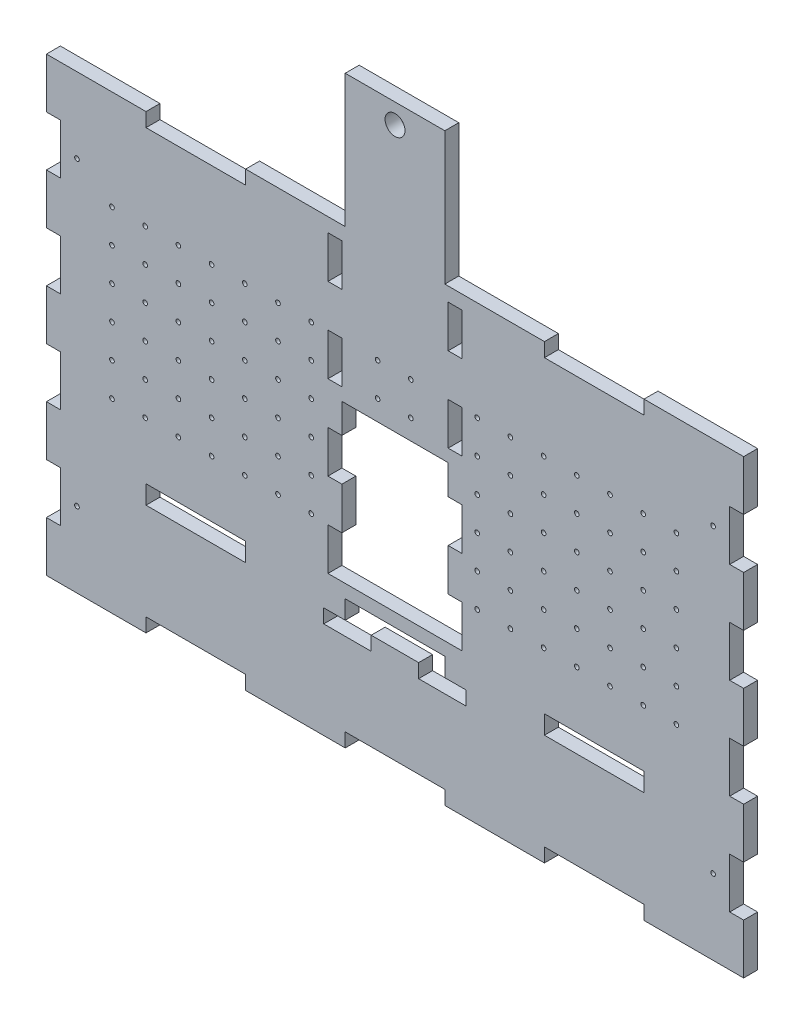
from build123d import *

# Parameters (mm, degrees)
SKETCH1_W           = 266.7
SKETCH1_H           = 172.72
BOSS_EXTRUDE1_DEPTH = 5.334
SKETCH2_W           = 38.1
SKETCH2_H           = 5.334
CUT_EXTRUDE1_DEPTH  = 165.701204222
SKETCH5_W           = 38.1
SKETCH5_H           = 7.112
CUT_EXTRUDE3_DEPTH  = 165.701204222
SKETCH8_W           = 18.149934459
SKETCH8_H           = 5.334
SKETCH8_W_2         = 18.14993446
CUT_EXTRUDE6_DEPTH  = 165.701204222
SKETCH9_W           = 5.334
SKETCH9_H           = 19.191111111
CUT_EXTRUDE7_DEPTH  = 165.701204222
SKETCH10_W          = 38.1
SKETCH10_H          = 5.334
BOSS_EXTRUDE2_DEPTH = 50.8
SKETCH11_W          = 6.604
SKETCH11_H          = 40.64
CUT_EXTRUDE8_DEPTH  = 197.710659379
SKETCH12_R          = 3.81
CUT_EXTRUDE9_DEPTH  = 197.710659379
SKETCH14_R          = 0.889
CUT_EXTRUDE11_DEPTH = 197.710659379
SKETCH15_W          = 6.604
SKETCH15_H          = 10.16
CUT_EXTRUDE12_DEPTH = 197.710659379
SKETCH16_W          = 40.64
SKETCH16_H          = 59.69
CUT_EXTRUDE13_DEPTH = 197.710659379
SKETCH17_W          = 5.334
SKETCH17_H          = 16.124650759
SKETCH17_H_2        = 16.124650758
CUT_EXTRUDE14_DEPTH = 197.710659379
SKETCH18_W          = 38.1
SKETCH18_H          = 56.134
BOSS_EXTRUDE3_DEPTH = 5.334
SKETCH19_W          = 34.756768033
SKETCH19_H          = 54.94363668
CUT_EXTRUDE15_DEPTH = 197.710659379
SKETCH20_R          = 3.81
CUT_EXTRUDE16_DEPTH = 197.710659379
SKETCH21_R          = 0.889
CUT_EXTRUDE17_DEPTH = 197.710659379


with BuildPart() as part:
    # Sketch1 → Boss-Extrude1 (new body)
    with BuildSketch(Plane.XY):
        with Locations((5.474099752, 2.104142138)):
            Rectangle(SKETCH1_W, SKETCH1_H)
    extrude(amount=BOSS_EXTRUDE1_DEPTH)

    # Sketch2 → Cut-Extrude1 (cut, through all)
    with BuildSketch(Plane.XY.offset(5.334)):
        with Locations((-70.725900248, -81.588857862)):
            Rectangle(SKETCH2_W, SKETCH2_H)
        with Locations((5.474099752, -81.588857862)):
            Rectangle(SKETCH2_W, SKETCH2_H)
        with Locations((81.674099752, -81.588857862)):
            Rectangle(SKETCH2_W, SKETCH2_H)
        with Locations((81.674099752, 85.797142138)):
            Rectangle(SKETCH2_W, SKETCH2_H)
        with Locations((5.474099752, 85.797142138)):
            Rectangle(SKETCH2_W, SKETCH2_H)
        with Locations((-70.725900248, 85.797142138)):
            Rectangle(SKETCH2_W, SKETCH2_H)
    extrude(amount=-CUT_EXTRUDE1_DEPTH, mode=Mode.SUBTRACT)

    # Sketch5 → Cut-Extrude3 (cut, through all)
    with BuildSketch(Plane.XY.offset(5.334)):
        with Locations((-70.725900248, -38.378413173)):
            Rectangle(SKETCH5_W, SKETCH5_H)
        with Locations((5.474099752, -38.378413173)):
            Rectangle(SKETCH5_W, SKETCH5_H)
        with Locations((81.674099752, -38.378413173)):
            Rectangle(SKETCH5_W, SKETCH5_H)
    extrude(amount=-CUT_EXTRUDE3_DEPTH, mode=Mode.SUBTRACT)

    # Sketch8 → Cut-Extrude6 (cut, through all)
    with BuildSketch(Plane.XY.offset(5.334)):
        with Locations((-12.722736397, -44.601413173)):
            Rectangle(SKETCH8_W, SKETCH8_H)
        with Locations((23.577132522, -44.601413173)):
            Rectangle(SKETCH8_W_2, SKETCH8_H)
    extrude(amount=-CUT_EXTRUDE6_DEPTH, mode=Mode.SUBTRACT)

    # Sketch9 → Cut-Extrude7 (cut, through all)
    with BuildSketch(Plane.XY.offset(5.334)):
        with Locations((-125.208900248, -55.469191196)):
            Rectangle(SKETCH9_W, SKETCH9_H)
        with Locations((-125.208900248, -17.086968973)):
            Rectangle(SKETCH9_W, SKETCH9_H)
        with Locations((-125.208900248, 21.295253249)):
            Rectangle(SKETCH9_W, SKETCH9_H)
        with Locations((-125.208900248, 59.677475472)):
            Rectangle(SKETCH9_W, SKETCH9_H)
        with Locations((136.157099752, 59.677475472)):
            Rectangle(SKETCH9_W, SKETCH9_H)
        with Locations((136.157099752, 21.295253249)):
            Rectangle(SKETCH9_W, SKETCH9_H)
        with Locations((136.157099752, -17.086968973)):
            Rectangle(SKETCH9_W, SKETCH9_H)
        with Locations((136.157099752, -55.469191196)):
            Rectangle(SKETCH9_W, SKETCH9_H)
    extrude(amount=-CUT_EXTRUDE7_DEPTH, mode=Mode.SUBTRACT)

    # Sketch10 → Boss-Extrude2 (add)
    with BuildSketch(Plane(origin=(0, 88.464142138, 0), x_dir=(1, 0, 0), z_dir=(0, 1, 0))):
        with Locations((43.574099752, -2.667)):
            Rectangle(SKETCH10_W, SKETCH10_H)
    extrude(amount=BOSS_EXTRUDE2_DEPTH)

    # Sketch11 → Cut-Extrude8 (cut, through all)
    with BuildSketch(Plane(origin=(0, 0, 0), x_dir=(-1, 0, 0), z_dir=(0, 0, -1))):
        with Locations((-27.826099752, 108.784142138)):
            Rectangle(SKETCH11_W, SKETCH11_H)
    extrude(amount=-CUT_EXTRUDE8_DEPTH, mode=Mode.SUBTRACT)

    # Sketch12 → Cut-Extrude9 (cut, through all)
    with BuildSketch(Plane.XY.offset(5.334)):
        with Locations((43.574099752, 130.476471297)):
            Circle(SKETCH12_R)
    extrude(amount=-CUT_EXTRUDE9_DEPTH, mode=Mode.SUBTRACT)

    # Sketch14 → Cut-Extrude11 (cut, through all)
    with BuildSketch(Plane.XY.offset(5.334)):
        with Locations((-102.797588144, 50.364142138)):
            Circle(SKETCH14_R)
        with Locations((-90.097588144, 50.364142138)):
            Circle(SKETCH14_R)
        with Locations((-77.397588144, 50.364142138)):
            Circle(SKETCH14_R)
        with Locations((-64.697588144, 50.364142138)):
            Circle(SKETCH14_R)
        with Locations((-51.997588144, 50.364142138)):
            Circle(SKETCH14_R)
        with Locations((-39.297588144, 50.364142138)):
            Circle(SKETCH14_R)
        with Locations((-26.597588144, 50.364142138)):
            Circle(SKETCH14_R)
        with Locations((-1.197588144, 50.364142138)):
            Circle(SKETCH14_R)
        with Locations((11.502411856, 50.364142138)):
            Circle(SKETCH14_R)
        with Locations((36.902411856, 50.364142138)):
            Circle(SKETCH14_R)
        with Locations((49.602411856, 50.364142138)):
            Circle(SKETCH14_R)
        with Locations((62.302411856, 50.364142138)):
            Circle(SKETCH14_R)
        with Locations((75.002411856, 50.364142138)):
            Circle(SKETCH14_R)
        with Locations((87.702411856, 50.364142138)):
            Circle(SKETCH14_R)
        with Locations((100.402411856, 50.364142138)):
            Circle(SKETCH14_R)
        with Locations((113.102411856, 50.364142138)):
            Circle(SKETCH14_R)
        with Locations((-102.797588144, 37.664142138)):
            Circle(SKETCH14_R)
        with Locations((-90.097588144, 37.664142138)):
            Circle(SKETCH14_R)
        with Locations((-77.397588144, 37.664142138)):
            Circle(SKETCH14_R)
        with Locations((-64.697588144, 37.664142138)):
            Circle(SKETCH14_R)
        with Locations((-51.997588144, 37.664142138)):
            Circle(SKETCH14_R)
        with Locations((-39.297588144, 37.664142138)):
            Circle(SKETCH14_R)
        with Locations((-26.597588144, 37.664142138)):
            Circle(SKETCH14_R)
        with Locations((-1.197588144, 37.664142138)):
            Circle(SKETCH14_R)
        with Locations((11.502411856, 37.664142138)):
            Circle(SKETCH14_R)
        with Locations((36.902411856, 37.664142138)):
            Circle(SKETCH14_R)
        with Locations((49.602411856, 37.664142138)):
            Circle(SKETCH14_R)
        with Locations((62.302411856, 37.664142138)):
            Circle(SKETCH14_R)
        with Locations((75.002411856, 37.664142138)):
            Circle(SKETCH14_R)
        with Locations((87.702411856, 37.664142138)):
            Circle(SKETCH14_R)
        with Locations((100.402411856, 37.664142138)):
            Circle(SKETCH14_R)
        with Locations((113.102411856, 37.664142138)):
            Circle(SKETCH14_R)
        with Locations((-102.797588144, 24.964142138)):
            Circle(SKETCH14_R)
        with Locations((-90.097588144, 24.964142138)):
            Circle(SKETCH14_R)
        with Locations((-77.397588144, 24.964142138)):
            Circle(SKETCH14_R)
        with Locations((-64.697588144, 24.964142138)):
            Circle(SKETCH14_R)
        with Locations((-51.997588144, 24.964142138)):
            Circle(SKETCH14_R)
        with Locations((-39.297588144, 24.964142138)):
            Circle(SKETCH14_R)
        with Locations((-26.597588144, 24.964142138)):
            Circle(SKETCH14_R)
        with Locations((-1.197588144, 24.964142138)):
            Circle(SKETCH14_R)
        with Locations((11.502411856, 24.964142138)):
            Circle(SKETCH14_R)
        with Locations((36.902411856, 24.964142138)):
            Circle(SKETCH14_R)
        with Locations((49.602411856, 24.964142138)):
            Circle(SKETCH14_R)
        with Locations((62.302411856, 24.964142138)):
            Circle(SKETCH14_R)
        with Locations((75.002411856, 24.964142138)):
            Circle(SKETCH14_R)
        with Locations((87.702411856, 24.964142138)):
            Circle(SKETCH14_R)
        with Locations((100.402411856, 24.964142138)):
            Circle(SKETCH14_R)
        with Locations((113.102411856, 24.964142138)):
            Circle(SKETCH14_R)
        with Locations((-102.797588144, 12.264142138)):
            Circle(SKETCH14_R)
        with Locations((-90.097588144, 12.264142138)):
            Circle(SKETCH14_R)
        with Locations((-77.397588144, 12.264142138)):
            Circle(SKETCH14_R)
        with Locations((-64.697588144, 12.264142138)):
            Circle(SKETCH14_R)
        with Locations((-51.997588144, 12.264142138)):
            Circle(SKETCH14_R)
        with Locations((-39.297588144, 12.264142138)):
            Circle(SKETCH14_R)
        with Locations((-26.597588144, 12.264142138)):
            Circle(SKETCH14_R)
        with Locations((36.902411856, 12.264142138)):
            Circle(SKETCH14_R)
        with Locations((49.602411856, 12.264142138)):
            Circle(SKETCH14_R)
        with Locations((62.302411856, 12.264142138)):
            Circle(SKETCH14_R)
        with Locations((75.002411856, 12.264142138)):
            Circle(SKETCH14_R)
        with Locations((87.702411856, 12.264142138)):
            Circle(SKETCH14_R)
        with Locations((100.402411856, 12.264142138)):
            Circle(SKETCH14_R)
        with Locations((113.102411856, 12.264142138)):
            Circle(SKETCH14_R)
        with Locations((-102.797588144, -0.435857862)):
            Circle(SKETCH14_R)
        with Locations((-90.097588144, -0.435857862)):
            Circle(SKETCH14_R)
        with Locations((-77.397588144, -0.435857862)):
            Circle(SKETCH14_R)
        with Locations((-64.697588144, -0.435857862)):
            Circle(SKETCH14_R)
        with Locations((-51.997588144, -0.435857862)):
            Circle(SKETCH14_R)
        with Locations((-39.297588144, -0.435857862)):
            Circle(SKETCH14_R)
        with Locations((-26.597588144, -0.435857862)):
            Circle(SKETCH14_R)
        with Locations((-13.897588144, -0.435857862)):
            Circle(SKETCH14_R)
        with Locations((-1.197588144, -0.435857862)):
            Circle(SKETCH14_R)
        with Locations((11.502411856, -0.435857862)):
            Circle(SKETCH14_R)
        with Locations((24.202411856, -0.435857862)):
            Circle(SKETCH14_R)
        with Locations((36.902411856, -0.435857862)):
            Circle(SKETCH14_R)
        with Locations((49.602411856, -0.435857862)):
            Circle(SKETCH14_R)
        with Locations((62.302411856, -0.435857862)):
            Circle(SKETCH14_R)
        with Locations((75.002411856, -0.435857862)):
            Circle(SKETCH14_R)
        with Locations((87.702411856, -0.435857862)):
            Circle(SKETCH14_R)
        with Locations((100.402411856, -0.435857862)):
            Circle(SKETCH14_R)
        with Locations((113.102411856, -0.435857862)):
            Circle(SKETCH14_R)
        with Locations((-102.797588144, -13.135857862)):
            Circle(SKETCH14_R)
        with Locations((-90.097588144, -13.135857862)):
            Circle(SKETCH14_R)
        with Locations((-77.397588144, -13.135857862)):
            Circle(SKETCH14_R)
        with Locations((-64.697588144, -13.135857862)):
            Circle(SKETCH14_R)
        with Locations((-51.997588144, -13.135857862)):
            Circle(SKETCH14_R)
        with Locations((-39.297588144, -13.135857862)):
            Circle(SKETCH14_R)
        with Locations((-26.597588144, -13.135857862)):
            Circle(SKETCH14_R)
        with Locations((-13.897588144, -13.135857862)):
            Circle(SKETCH14_R)
        with Locations((-1.197588144, -13.135857862)):
            Circle(SKETCH14_R)
        with Locations((11.502411856, -13.135857862)):
            Circle(SKETCH14_R)
        with Locations((24.202411856, -13.135857862)):
            Circle(SKETCH14_R)
        with Locations((36.902411856, -13.135857862)):
            Circle(SKETCH14_R)
        with Locations((49.602411856, -13.135857862)):
            Circle(SKETCH14_R)
        with Locations((62.302411856, -13.135857862)):
            Circle(SKETCH14_R)
        with Locations((75.002411856, -13.135857862)):
            Circle(SKETCH14_R)
        with Locations((87.702411856, -13.135857862)):
            Circle(SKETCH14_R)
        with Locations((100.402411856, -13.135857862)):
            Circle(SKETCH14_R)
        with Locations((113.102411856, -13.135857862)):
            Circle(SKETCH14_R)
    extrude(amount=-CUT_EXTRUDE11_DEPTH, mode=Mode.SUBTRACT)

    # Sketch15 → Cut-Extrude12 (cut, through all)
    with BuildSketch(Plane.XY.offset(5.334)):
        with Locations((27.826099752, 134.184142138)):
            Rectangle(SKETCH15_W, SKETCH15_H)
    extrude(amount=-CUT_EXTRUDE12_DEPTH, mode=Mode.SUBTRACT)

    # Sketch16 → Cut-Extrude13 (cut, through all)
    with BuildSketch(Plane.XY.offset(5.334)):
        with Locations((5.474099752, 0.102586827)):
            Rectangle(SKETCH16_W, SKETCH16_H)
    extrude(amount=-CUT_EXTRUDE13_DEPTH, mode=Mode.SUBTRACT)

    # Sketch17 → Cut-Extrude14 (cut, through all)
    with BuildSketch(Plane.XY.offset(5.334)):
        with Locations((-17.512900248, -21.680087794)):
            Rectangle(SKETCH17_W, SKETCH17_H)
        with Locations((-17.512900248, 10.569213724)):
            Rectangle(SKETCH17_W, SKETCH17_H)
        with Locations((-17.512900248, 42.818515241)):
            Rectangle(SKETCH17_W, SKETCH17_H_2)
        with Locations((-17.512900248, 75.067816759)):
            Rectangle(SKETCH17_W, SKETCH17_H)
        with Locations((28.461099752, 75.067816759)):
            Rectangle(SKETCH17_W, SKETCH17_H)
        with Locations((28.461099752, 42.818515241)):
            Rectangle(SKETCH17_W, SKETCH17_H_2)
        with Locations((28.461099752, 10.569213724)):
            Rectangle(SKETCH17_W, SKETCH17_H)
        with Locations((28.461099752, -21.680087794)):
            Rectangle(SKETCH17_W, SKETCH17_H)
    extrude(amount=-CUT_EXTRUDE14_DEPTH, mode=Mode.SUBTRACT)

    # Sketch18 → Boss-Extrude3 (add)
    with BuildSketch(Plane.XY.offset(5.334)):
        with Locations((5.474099752, 111.197142138)):
            Rectangle(SKETCH18_W, SKETCH18_H)
    extrude(amount=-BOSS_EXTRUDE3_DEPTH)

    # Sketch19 → Cut-Extrude15 (cut, through all)
    with BuildSketch(Plane.XY.offset(5.334)):
        with Locations((48.506483768, 115.935960478)):
            Rectangle(SKETCH19_W, SKETCH19_H)
    extrude(amount=-CUT_EXTRUDE15_DEPTH, mode=Mode.SUBTRACT)

    # Sketch20 → Cut-Extrude16 (cut, through all)
    with BuildSketch(Plane.XY.offset(5.334)):
        with Locations((5.474099752, 131.644142138)):
            Circle(SKETCH20_R)
    extrude(amount=-CUT_EXTRUDE16_DEPTH, mode=Mode.SUBTRACT)

    # Sketch21 → Cut-Extrude17 (cut, through all)
    with BuildSketch(Plane.XY.offset(5.334)):
        with Locations((127.140099752, 59.677475471)):
            Circle(SKETCH21_R)
        with Locations((-116.191900248, 59.677475471)):
            Circle(SKETCH21_R)
        with Locations((-116.191900248, -55.469191196)):
            Circle(SKETCH21_R)
        with Locations((127.140099752, -55.469191196)):
            Circle(SKETCH21_R)
    extrude(amount=-CUT_EXTRUDE17_DEPTH, mode=Mode.SUBTRACT)


solid = part.part
